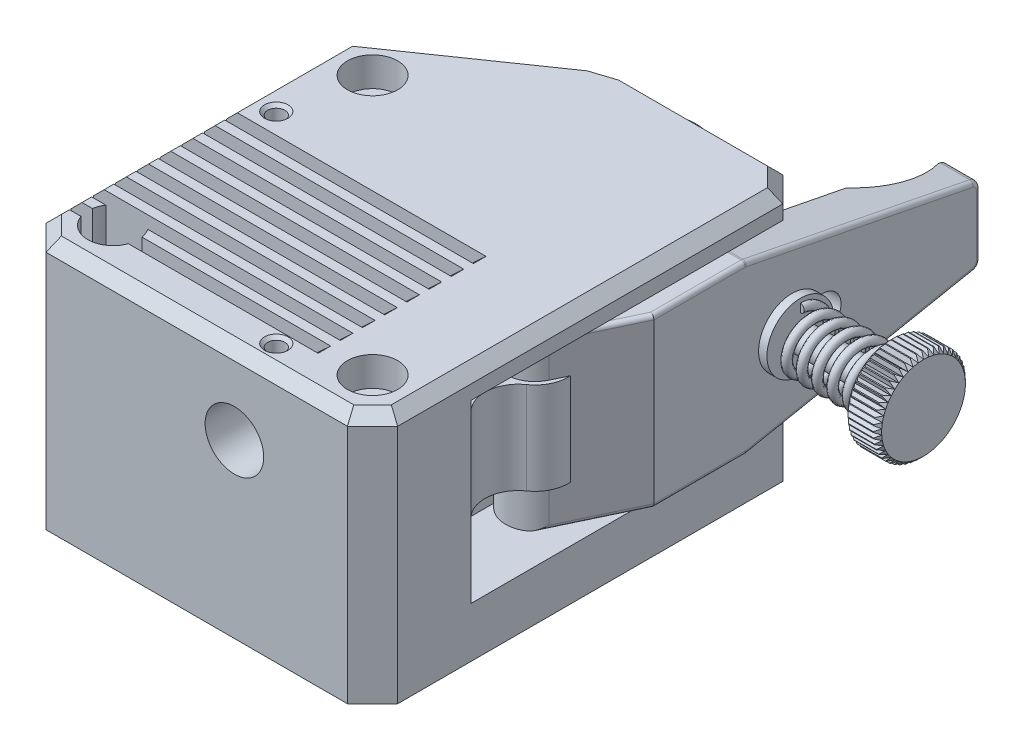
from build123d import *

# Parameters (mm, degrees)
AUFSATZ_LINEAR_AUSTRAGEN1_DEPTH      = 15
SCHNITT_LINEAR_AUSTRAGEN1_DEPTH      = 74.266636336
SCHNITT_LINEAR_AUSTRAGEN1_DEPTH_BACK = 74.266636336
SKIZZE2_R                            = 1.6
FASE1_SIZE                           = 1.3
SKIZZE3_R                            = 3
SCHNITT_LINEAR_AUSTRAGEN2_DEPTH      = 3.5
SKIZZE3_2_R                          = 3
SCHNITT_LINEAR_AUSTRAGEN3_DEPTH      = 11
SCHNITT_LINEAR_START                 = -4.5
SCHNITT_LINEAR_AUSTRAGEN4_DEPTH      = 1.5
LINEARES_MUSTER1_COUNT               = 8
LINEARES_MUSTER1_PITCH               = 2.65
SKIZZE5_R                            = 1
SCHNITT_LINEAR_AUSTRAGEN5_DEPTH      = 2
M2_5_GEWINDEBOHRUNG1_D               = 2.05
M2_5_GEWINDEBOHRUNG1_DEPTH           = 5
M2_5_GEWINDEBOHRUNG1_CSINK_D         = 2.8
M2_5_GEWINDEBOHRUNG1_CSINK_ANGLE     = 90
M2_5_GEWINDEBOHRUNG1_TIP             = 0.615882135
SCHNITT_LINEAR_AUSTRAGEN6_DEPTH      = 10
SKIZZE9_R                            = 11.1
SCHNITT_LINEAR_AUSTRAGEN7_DEPTH      = 10
SCHNITT_LINEAR_START_2               = -6
SCHNITT_LINEAR_AUSTRAGEN8_DEPTH      = 21
SCHNITT_LINEAR_AUSTRAGEN9_DEPTH      = 5
SCHNITT_LINEAR_START_3               = -27
SCHNITT_LINEAR_AUSTRAGEN10_DEPTH     = 5
AUFSATZ_LINEAR_START                 = 1.5
AUFSATZ_LINEAR_AUSTRAGEN2_DEPTH      = 10
SCHNITT_LINEAR_AUSTRAGEN11_REACH     = 86.658
VERRUNDUNG1_R                        = 1
SCHNITT_LINEAR_AUSTRAGEN12_REACH     = 86.658
SCHNITT_LINEAR_AUSTRAGEN13_DEPTH     = 15
AUSTRAGUNG1_PITCH                    = 1.833333333
AUSTRAGUNG1_HEIGHT                   = 11
AUSTRAGUNG1_RADIUS                   = 3
AUSTRAGUNG1_START_ANGLE              = -90
SKIZZE21_R                           = 0.5
FASE2_SIZE                           = 0.5
SCHNITT_LINEAR_AUSTRAGEN14_REACH     = 95.715
KREISMUSTER1_COUNT                   = 50
SKIZZE23_R                           = 3.5
SCHNITT_LINEAR_AUSTRAGEN15_DEPTH     = 30
VERRUNDUNG2_R                        = 0.5


with BuildPart() as part:
    # Skizze1 → Aufsatz-Linear austragen1 (new, symmetric)
    with BuildSketch(Plane(origin=(0, 0, 0), x_dir=(1, 0, 0), z_dir=(0, 1, 0))):
        Polygon((0, 3), (3, 0), (39, 0), (42, 3), (42, 49), (39, 52), (20.5, 52), (17.26426074, 50.955973449), (0, 39), align=None)
    extrude(amount=AUFSATZ_LINEAR_AUSTRAGEN1_DEPTH, both=True)

    # Skizze2 → Schnitt-Linear austragen1 (cut, two sides: drawn at the far end of the back side and taken through both)
    with BuildSketch(Plane(origin=(0, 15, 0), x_dir=(1, 0, 0), z_dir=(0, 1, 0)).offset(-SCHNITT_LINEAR_AUSTRAGEN1_DEPTH_BACK)):
        with Locations(Location((36.5, 5.5, 0), (0, 0, 270))):
            Circle(SKIZZE2_R)
        with Locations(Location((5.5, 5.5, 0), (0, 0, 270))):
            Circle(SKIZZE2_R)
        with Locations(Location((5.5, 36.5, 0), (0, 0, 270))):
            Circle(SKIZZE2_R)
    extrude(amount=SCHNITT_LINEAR_AUSTRAGEN1_DEPTH + SCHNITT_LINEAR_AUSTRAGEN1_DEPTH_BACK, mode=Mode.SUBTRACT)

    # Fase1
    fase1_edges = [part.edges().sort_by_distance(p)[0] for p in [
        (21, 15, 0),
        (40.5, 15, -1.5),
        (42, 15, -26),
        (40.5, 15, -50.5),
        (29.75, 15, -52),
        (18.88213037, 15, -51.477986724),
        (8.63213037, 15, -44.977986724),
        (0, 15, -21),
        (1.5, 15, -1.5),
    ]]
    chamfer(fase1_edges, length=FASE1_SIZE)

    # Skizze3 → Schnitt-Linear austragen2 (cut)
    with BuildSketch(Plane(origin=(0, 15, 0), x_dir=(1, 0, 0), z_dir=(0, 1, 0))):
        with Locations(Location((5.5, 5.5, 0), (0, 0, 270))):
            Circle(SKIZZE3_R)
        with Locations(Location((36.5, 5.5, 0), (0, 0, 270))):
            Circle(SKIZZE3_R)
        with Locations(Location((5.5, 36.5, 0), (0, 0, 270))):
            Circle(SKIZZE3_R)
    extrude(amount=-SCHNITT_LINEAR_AUSTRAGEN2_DEPTH, mode=Mode.SUBTRACT)

    # Skizze3<2> → Schnitt-Linear austragen3 (cut)
    with BuildSketch(Plane(origin=(0, 15, 0), x_dir=(1, 0, 0), z_dir=(0, 1, 0))):
        with Locations(Location((5.5, 5.5, 0), (0, 0, 270))):
            Circle(SKIZZE3_2_R)
    extrude(amount=-SCHNITT_LINEAR_AUSTRAGEN3_DEPTH, mode=Mode.SUBTRACT)

    # Skizze4 → Schnitt-Linear austragen4 (cut)
    with BuildSketch(Plane.XY.offset(SCHNITT_LINEAR_START)):
        with BuildLine():
            Line((0, 15), (31, 15))
            ThreePointArc((31, 15), (23.67616052, 9.420773209), (15.150830765, 5.944403137))
            ThreePointArc((15.150830765, 5.944403137), (7.637545031, 4.488086017), (0, 4))
            Line((0, 4), (0, 15))
        make_face()
    schnitt_linear_austragen4 = extrude(amount=-SCHNITT_LINEAR_AUSTRAGEN4_DEPTH, mode=Mode.SUBTRACT)

    # Lineares Muster1: Schnitt-Linear austragen4 ×8
    with Locations(*[(0, 0, -i * LINEARES_MUSTER1_PITCH) for i in range(1, LINEARES_MUSTER1_COUNT)]):
        add(schnitt_linear_austragen4, mode=Mode.SUBTRACT)

    # Skizze5 → Schnitt-Linear austragen5 (cut)
    with BuildSketch(Plane(origin=(0, 15, 0), x_dir=(1, 0, 0), z_dir=(0, 1, 0))):
        with Locations(Location((3.5, 27, 0), (0, 0, 270))):
            Circle(SKIZZE5_R)
        with Locations(Location((27.5, 3, 0), (0, 0, 270))):
            Circle(SKIZZE5_R)
    extrude(amount=-SCHNITT_LINEAR_AUSTRAGEN5_DEPTH, mode=Mode.SUBTRACT)

    # M2.5 Gewindebohrung1
    with Locations(Plane(origin=(3.5, 15, -27), x_dir=(0, 0, 1), z_dir=(0, 1, 0))):
        with Locations((0, 0), (24, 24)):
            CounterSinkHole(M2_5_GEWINDEBOHRUNG1_D / 2, M2_5_GEWINDEBOHRUNG1_CSINK_D / 2, depth=M2_5_GEWINDEBOHRUNG1_DEPTH, counter_sink_angle=M2_5_GEWINDEBOHRUNG1_CSINK_ANGLE)
            with Locations((0, 0, -(M2_5_GEWINDEBOHRUNG1_DEPTH + M2_5_GEWINDEBOHRUNG1_TIP / 2))):  # 118° drill point
                Cone(0, M2_5_GEWINDEBOHRUNG1_D / 2, M2_5_GEWINDEBOHRUNG1_TIP, mode=Mode.SUBTRACT)

    # Skizze8 → Schnitt-Linear austragen6 (cut)
    with BuildSketch(Plane.XZ.offset(15)):
        with BuildLine():
            Line((34, -52), (26.585786438, -44.585786438))
            ThreePointArc((26.585786438, -44.585786438), (25.93693974, -44.152240935), (25.171572875, -44))
            Line((25.171572875, -44), (7.21993103, -44))
            Line((7.21993103, -44), (18.771820678, -52))
            Line((18.771820678, -52), (34, -52))
        make_face()
    extrude(amount=-SCHNITT_LINEAR_AUSTRAGEN6_DEPTH, mode=Mode.SUBTRACT)

    # Skizze9 → Schnitt-Linear austragen7 (cut)
    with BuildSketch(Plane.XZ.offset(15)):
        with Locations(Location((21, -21, 0), (0, 0, 270))):
            Circle(SKIZZE9_R)
    extrude(amount=-SCHNITT_LINEAR_AUSTRAGEN7_DEPTH, mode=Mode.SUBTRACT)

    # Skizze10 → Schnitt-Linear austragen8 (cut)
    with BuildSketch(Plane.XZ.offset(15).offset(SCHNITT_LINEAR_START_2)):
        with BuildLine():
            Line((37.8, -52), (37.8, -44))
            Line((37.8, -44), (32, -44))
            Line((32, -44), (32, -29))
            Line((32, -29), (36.406020804, -29))
            ThreePointArc((36.406020804, -29), (40.222750094, -26.196903309), (38.690148762, -21.716288765))
            ThreePointArc((38.690148762, -21.716288765), (36.990043581, -18.787382126), (38.145849594, -15.604150406))
            Line((38.145849594, -15.604150406), (42, -11.75))
            Line((42, -11.75), (42, -52))
            Line((42, -52), (37.8, -52))
        make_face()
    extrude(amount=-SCHNITT_LINEAR_AUSTRAGEN8_DEPTH, mode=Mode.SUBTRACT)

    # Skizze11 → Schnitt-Linear austragen9 (cut)
    with BuildSketch(Plane.XZ.offset(15).offset(SCHNITT_LINEAR_START_2)):
        Polygon((42, -11.75), (33, -20.75), (33, -39.825468714), (42, -39.825468714), align=None)
    extrude(amount=-SCHNITT_LINEAR_AUSTRAGEN9_DEPTH, mode=Mode.SUBTRACT)

    # Skizze11<2> → Schnitt-Linear austragen10 (cut)
    with BuildSketch(Plane.XZ.offset(15).offset(SCHNITT_LINEAR_START_3)):
        Polygon((42, -11.75), (33, -20.75), (33, -39.825468714), (42, -39.825468714), align=None)
    extrude(amount=SCHNITT_LINEAR_AUSTRAGEN10_DEPTH, mode=Mode.SUBTRACT)

    # Skizze12 → Aufsatz-Linear austragen2 (add, symmetric)
    with BuildSketch(Plane(origin=(0, 0, 0), x_dir=(1, 0, 0), z_dir=(0, 1, 0)).offset(AUFSATZ_LINEAR_START)):
        with BuildLine():
            Line((43.6, 71), (43.6, 32))
            Line((43.6, 32), (39.568327633, 23.500061495))
            ThreePointArc((39.568327633, 23.500061495), (35.137289235, 21.738049632), (33.061305288, 26.030959803))
            Line((33.061305288, 26.030959803), (38.6, 44))
            Line((38.6, 44), (38.6, 71))
            Line((38.6, 71), (43.6, 71))
        make_face()
    extrude(amount=AUFSATZ_LINEAR_AUSTRAGEN2_DEPTH, both=True)

    # Skizze14 → Schnitt-Linear austragen11 (cut, up to next)
    with BuildSketch(Plane(origin=(43.6, 0, 0), x_dir=(0, 0, -1), z_dir=(1, 0, 0)), mode=Mode.PRIVATE) as schnitt_linear_austragen11_sk1:
        Polygon((71, 6), (43, 11.5), (71, 11.5), align=None)
    schnitt_linear_austragen11_tool1 = extrude(schnitt_linear_austragen11_sk1.sketch, amount=-SCHNITT_LINEAR_AUSTRAGEN11_REACH, mode=Mode.PRIVATE) & part.part
    # Skizze14 → Schnitt-Linear austragen11 (cut, up to next)
    with BuildSketch(Plane(origin=(43.6, 0, 0), x_dir=(0, 0, -1), z_dir=(1, 0, 0)), mode=Mode.PRIVATE) as schnitt_linear_austragen11_sk2:
        Polygon((71, -8.5), (71, -3), (43, -8.5), align=None)
    schnitt_linear_austragen11_tool2 = extrude(schnitt_linear_austragen11_sk2.sketch, amount=-SCHNITT_LINEAR_AUSTRAGEN11_REACH, mode=Mode.PRIVATE) & part.part
    add(schnitt_linear_austragen11_tool1.solids().sort_by_distance((43.6, 9.666667, -61.666667))[0], mode=Mode.SUBTRACT)
    add(schnitt_linear_austragen11_tool2.solids().sort_by_distance((43.6, -6.666667, -61.666667))[0], mode=Mode.SUBTRACT)

    # Verrundung1
    verrundung1_edges = [part.edges().sort_by_distance(p)[0] for p in [
        (41.1, 6, -71),
        (40.945882288, 11.5, -43),
        (40.945882288, -8.5, -43),
        (41.1, -3, -71),
    ]]
    fillet(verrundung1_edges, radius=VERRUNDUNG1_R)

    # Skizze15 → Schnitt-Linear austragen12 (cut, up to next)
    with BuildSketch(Plane(origin=(43.6, 0, 0), x_dir=(0, 0, -1), z_dir=(1, 0, 0)), mode=Mode.PRIVATE) as schnitt_linear_austragen12_sk1:
        with BuildLine():
            Line((52.2, -0.65), (48.8, -0.65))
            ThreePointArc((48.8, -0.65), (46.65, 1.5), (48.8, 3.65))
            Line((48.8, 3.65), (52.2, 3.65))
            ThreePointArc((52.2, 3.65), (54.35, 1.5), (52.2, -0.65))
        make_face()
    schnitt_linear_austragen12_tool1 = extrude(schnitt_linear_austragen12_sk1.sketch, amount=-SCHNITT_LINEAR_AUSTRAGEN12_REACH, mode=Mode.PRIVATE) & part.part
    add(schnitt_linear_austragen12_tool1.solids().sort_by_distance((43.6, 1.5, -50.5))[0], mode=Mode.SUBTRACT)

    # Skizze16 → Schnitt-Linear austragen13 (cut, symmetric)
    with BuildSketch(Plane(origin=(0, 0, 0), x_dir=(1, 0, 0), z_dir=(0, 1, 0))):
        with BuildLine():
            Line((39.6, 71), (38.6, 71))
            Line((38.6, 71), (38.6, 60))
            ThreePointArc((38.6, 60), (40.357700723, 64.874229928), (39.6, 70))
            Line((39.6, 70), (39.6, 71))
        make_face()
    extrude(amount=SCHNITT_LINEAR_AUSTRAGEN13_DEPTH, both=True, mode=Mode.SUBTRACT)

    # Skizze18 → Rotation1 (revolve)
    with BuildSketch(Plane(origin=(0, 1.5, 0), x_dir=(1, 0, 0), z_dir=(0, 1, 0)), mode=Mode.PRIVATE) as rotation1_sk:
        Polygon((55.3, 50), (55.3, 54), (59.3, 54), (59.3, 48.5), (37.8, 48.5), (37.8, 50), (43.6, 50), (43.6, 52.5), (44.6, 52.5), (44.6, 50), align=None)
    revolve(rotation1_sk.sketch.rotate(Axis((37.8, 1.5, -48.5), (1, 0, 0)), 180), axis=Axis((37.8, 1.5, -48.5), (1, 0, 0)))

    # Austragung1: sweep along a helix
    with BuildLine() as austragung1_path:
        add(Helix(AUSTRAGUNG1_PITCH, AUSTRAGUNG1_HEIGHT, AUSTRAGUNG1_RADIUS, center=(44.6, 1.5, -48.5), direction=(1, 0, 0), lefthand=True, mode=Mode.PRIVATE).rotate(Axis((44.6, 1.5, -48.5), (1, 0, 0)), AUSTRAGUNG1_START_ANGLE))
    # Skizze21 → Austragung1 (sweep)
    with BuildSketch(Plane(origin=(44.6, 4.5, -48.5), x_dir=(-0.9953034098543353, 0, -0.09680455739443966), z_dir=(0.09680455739443966, 4.424800295645345e-15, -0.9953034098543353))):
        Circle(SKIZZE21_R)
    sweep(path=austragung1_path.line, is_frenet=True)

    # Fase2
    fase2_edges = [part.edges().sort_by_distance(p)[0] for p in [
        (59.3, 1.5, -54),
        (55.3, 1.5, -54),
    ]]
    chamfer(fase2_edges, length=FASE2_SIZE)

    # Skizze22 → Schnitt-Linear austragen14 (cut, up to next)
    with BuildSketch(Plane(origin=(59.3, 0, 0), x_dir=(0, 0, -1), z_dir=(1, 0, 0)), mode=Mode.PRIVATE) as schnitt_linear_austragen14_sk1:
        Polygon((48.2, 7), (48.8, 7), (48.5, 6.5), align=None)
    schnitt_linear_austragen14_tool1 = extrude(schnitt_linear_austragen14_sk1.sketch, amount=-SCHNITT_LINEAR_AUSTRAGEN14_REACH, mode=Mode.PRIVATE) & part.part
    schnitt_linear_austragen14 = schnitt_linear_austragen14_tool1.solids().sort_by_distance((59.3, 6.833333, -48.5))[0]
    add(schnitt_linear_austragen14, mode=Mode.SUBTRACT)

    # Kreismuster1: Schnitt-Linear austragen14 ×50 about axis
    kreismuster1_axis = Axis((0, 1.5, -48.5), (1, 0, 0))
    for i in range(1, KREISMUSTER1_COUNT):
        add(schnitt_linear_austragen14.rotate(kreismuster1_axis, i * 360 / KREISMUSTER1_COUNT), mode=Mode.SUBTRACT)

    # Skizze23 → Schnitt-Linear austragen15 (cut)
    with BuildSketch(Plane.XY):
        with Locations((25.5, 5.5)):
            Circle(SKIZZE23_R)
    extrude(amount=-SCHNITT_LINEAR_AUSTRAGEN15_DEPTH, mode=Mode.SUBTRACT)

    # Verrundung2
    # the kernel refuses this fillet: 0.5 mm, written as the material it takes off along each edge
    with BuildSketch(Plane(origin=(44.135692323, 11.5, -33.129395296), x_dir=(-0.9035162368297793, 0, -0.428553858674676), z_dir=(-0.42855385867467594, 0, 0.9035162368297793))) as verrundung2_piece_1:
        with BuildLine():
            CenterArc((VERRUNDUNG2_R, VERRUNDUNG2_R), VERRUNDUNG2_R, 180, 90)
            Line((0, VERRUNDUNG2_R), (0, 0))
            Line((0, 0), (VERRUNDUNG2_R, 0))
        make_face()
    extrude(amount=12.782621201, mode=Mode.SUBTRACT)
    with BuildSketch(Plane(origin=(43.6, -8.5, -42.902715246), x_dir=(0, 1, 0), z_dir=(0, 0, 1))) as verrundung2_piece_2:
        with BuildLine():
            CenterArc((VERRUNDUNG2_R, VERRUNDUNG2_R), VERRUNDUNG2_R, 180, 90)
            Line((0, VERRUNDUNG2_R), (0, 0))
            Line((0, 0), (VERRUNDUNG2_R, 0))
        make_face()
    extrude(amount=12.152715246, mode=Mode.SUBTRACT)
    with BuildSketch(Plane(origin=(43.6, -3.158567887, -70.192745304), x_dir=(-1.4210854715202105e-14, 0.9812488205210874, 0.19274530403092788), z_dir=(0, -0.19274530403092788, 0.9812488205210874))) as verrundung2_piece_3:
        with BuildLine():
            CenterArc((VERRUNDUNG2_R, VERRUNDUNG2_R), VERRUNDUNG2_R, 180, 90)
            Line((0, VERRUNDUNG2_R), (0, 0))
            Line((0, 0), (VERRUNDUNG2_R, 0))
        make_face()
    extrude(amount=27.615100459, mode=Mode.SUBTRACT)
    with BuildSketch(Plane(origin=(43.6, -2.177319066, -71), x_dir=(0, 0, 1), z_dir=(0, 1, 0))) as verrundung2_piece_4:
        with BuildLine():
            CenterArc((VERRUNDUNG2_R, -VERRUNDUNG2_R), VERRUNDUNG2_R, 90, 90)
            Line((0, -VERRUNDUNG2_R), (0, 0))
            Line((0, 0), (VERRUNDUNG2_R, 0))
        make_face()
    extrude(amount=7.354638132, mode=Mode.SUBTRACT)
    with BuildSketch(Plane(origin=(43.6, 6.158567887, -70.192745304), x_dir=(-1.421085471520208e-14, -0.9812488205210874, 0.1927453040309279), z_dir=(0, 0.19274530403092793, 0.9812488205210874))) as verrundung2_piece_5:
        with BuildLine():
            CenterArc((VERRUNDUNG2_R, -VERRUNDUNG2_R), VERRUNDUNG2_R, 90, 90)
            Line((0, -VERRUNDUNG2_R), (0, 0))
            Line((0, 0), (VERRUNDUNG2_R, 0))
        make_face()
    extrude(amount=27.615100459, mode=Mode.SUBTRACT)
    with BuildSketch(Plane(origin=(44.135692323, -8.5, -33.129395296), x_dir=(-0.9035162368297793, 0, -0.428553858674676), z_dir=(-0.42855385867467594, 0, 0.9035162368297793))) as verrundung2_piece_6:
        with BuildLine():
            CenterArc((VERRUNDUNG2_R, -VERRUNDUNG2_R), VERRUNDUNG2_R, 90, 90)
            Line((0, -VERRUNDUNG2_R), (0, 0))
            Line((0, 0), (VERRUNDUNG2_R, 0))
        make_face()
    extrude(amount=12.782621201, mode=Mode.SUBTRACT)
    with BuildSketch(Plane(origin=(43.6, 11.5, -42.902715246), x_dir=(0, -1, 0), z_dir=(0, 0, 1))) as verrundung2_piece_7:
        with BuildLine():
            CenterArc((VERRUNDUNG2_R, -VERRUNDUNG2_R), VERRUNDUNG2_R, 90, 90)
            Line((0, -VERRUNDUNG2_R), (0, 0))
            Line((0, 0), (VERRUNDUNG2_R, 0))
        make_face()
    extrude(amount=12.152715246, mode=Mode.SUBTRACT)
    with BuildSketch(Plane(origin=(43.6, 10.5, -42.902715246), x_dir=(0, 1, 0), z_dir=(0, 0, 1))) as verrundung2_piece_8:
        with BuildLine():
            CenterArc((1 - VERRUNDUNG2_R, VERRUNDUNG2_R), VERRUNDUNG2_R, 270, 90)
            Line((1, VERRUNDUNG2_R), (1, 0))
            Line((1, 0), (1 - VERRUNDUNG2_R, 0))
        make_face()
    revolve(axis=Axis((43.6, 10.5, -42.902715246), (-1, 0, 0)), revolution_arc=11.113040536, mode=Mode.SUBTRACT)
    with BuildSketch(Plane(origin=(43.6, 5.177319066, -70), x_dir=(0, 0.9812488205210887, -0.19274530403092163), z_dir=(0, 0.19274530403092163, 0.9812488205210887))) as verrundung2_piece_9:
        with BuildLine():
            CenterArc((1 - VERRUNDUNG2_R, VERRUNDUNG2_R), VERRUNDUNG2_R, 270, 90)
            Line((1, VERRUNDUNG2_R), (1, 0))
            Line((1, 0), (1 - VERRUNDUNG2_R, 0))
        make_face()
    revolve(axis=Axis((43.6, 5.177319066, -70), (-1, 0, 0)), revolution_arc=78.886959464, mode=Mode.SUBTRACT)
    with BuildSketch(Plane(origin=(43.6, -2.177319066, -70), x_dir=(0, -0.9812488205210887, -0.19274530403092172), z_dir=(0, -0.19274530403092172, 0.9812488205210887))) as verrundung2_piece_10:
        with BuildLine():
            CenterArc((1 - VERRUNDUNG2_R, -VERRUNDUNG2_R), VERRUNDUNG2_R, 0, 90)
            Line((1, -VERRUNDUNG2_R), (1, 0))
            Line((1, 0), (1 - VERRUNDUNG2_R, 0))
        make_face()
    revolve(axis=Axis((43.6, -2.177319066, -70), (1, 0, 0)), revolution_arc=78.886959464, mode=Mode.SUBTRACT)
    with BuildSketch(Plane(origin=(43.6, -7.5, -42.902715246), x_dir=(0, -1, 0), z_dir=(0, 0, 1))) as verrundung2_piece_11:
        with BuildLine():
            CenterArc((1 - VERRUNDUNG2_R, -VERRUNDUNG2_R), VERRUNDUNG2_R, 0, 90)
            Line((1, -VERRUNDUNG2_R), (1, 0))
            Line((1, 0), (1 - VERRUNDUNG2_R, 0))
        make_face()
    revolve(axis=Axis((43.6, -7.5, -42.902715246), (1, 0, 0)), revolution_arc=11.113040536, mode=Mode.SUBTRACT)

    # Skizze25 → Rotation2 (revolve)
    with BuildSketch(Plane(origin=(0, 5.5, 0), x_dir=(1, 0, 0), z_dir=(0, 1, 0)), mode=Mode.PRIVATE) as rotation2_sk:
        Polygon((20.3, 52), (23.25, 52), (23.25, 55.1), (20.3, 55.1), (20.3, 54), (22.25, 54), (22.25, 53), (20.3, 53), align=None)
    revolve(rotation2_sk.sketch.rotate(Axis((25.5, 5.5, 0), (0, 0, -1)), 180), axis=Axis((25.5, 5.5, 0), (0, 0, -1)))


solid = part.part
